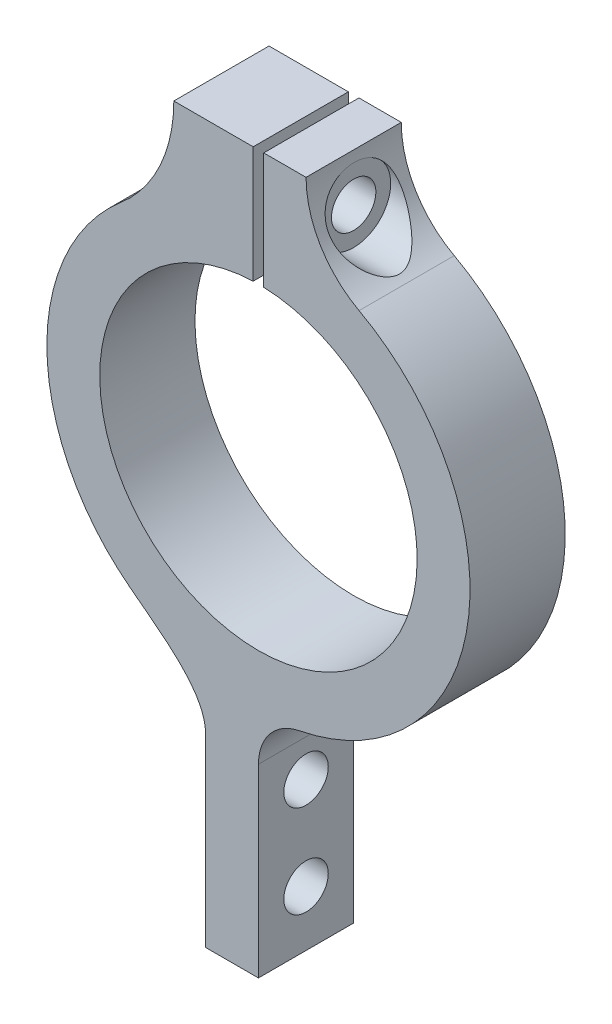
from build123d import *

# Parameters (mm, degrees)
MAIN_BODY_DEPTH      = 18
SKETCH14_W           = 4.2
SKETCH14_H           = 39
M8_CLEARANCE_HOLE2_D = 8.4
M8_CLEARANCE_HOLE3_D = 8.4
SKETCH27_R           = 7
CUT_EXTRUDE2_DEPTH   = 99.559772913


with BuildPart() as part:
    # Sketch1 → main body (new body)
    with BuildSketch(Plane.XY):
        with BuildLine():
            Line((0, -48.600411521), (0, -83.600411521))
            Line((0, -83.600411521), (-10, -83.600411521))
            Line((-10, -83.600411521), (-10, -48.600411521))
            add(Edge.make_bspline(
                [(-26.535230031, -29.931280748), (-20.948212629, -34.88438627), (-10, -40.904022772), (-10, -48.600411521)],
                knots=[0, 0, 0, 0, 1, 1, 1, 1], degree=3))
            ThreePointArc((-26.535230031, -29.931280748), (-39.998128482, 0.386934068), (-25.951219512, 30.43902439))
            ThreePointArc((-25.951219512, 30.43902439), (-18.607817439, 40.126684972), (-16, 52))
            Line((-16, 52), (-1, 52))
            Line((-1, 52), (-1, 29.983328701))
            ThreePointArc((-1, 29.983328701), (0, -30), (1, 29.983328701))
            Line((1, 29.983328701), (1, 52))
            Line((1, 52), (9, 52))
            ThreePointArc((9, 52), (11.695932832, 42.212959957), (19.02319236, 35.186903138))
            ThreePointArc((19.02319236, 35.186903138), (39.54457484, -6.018853774), (7.693084301, -39.253234949))
            ThreePointArc((7.693084301, -39.253234949), (2.170592409, -42.547452411), (0, -48.600411521))
        make_face()
    extrude(amount=MAIN_BODY_DEPTH)

    # Sketch14 → M8 Clearance Hole1 (revolve, cut)
    with BuildSketch(Plane(origin=(1, 43, 9), x_dir=(0, 0, 1), z_dir=(0, 1, 0))):
        with Locations((2.1, 19.5)):
            Rectangle(SKETCH14_W, SKETCH14_H)
    revolve(axis=Axis((-5.35, 43, 9), (1, 0, 0)), mode=Mode.SUBTRACT)

    # M8 Clearance Hole2 (through all)
    with Locations(Plane(origin=(1, 0, 0), x_dir=(0, 0, 1), z_dir=(1, 0, 0))):
        with Locations((9, -43)):
            Hole(M8_CLEARANCE_HOLE2_D / 2)

    # M8 Clearance Hole3 (through all)
    with Locations(Plane(origin=(0, 0, 0), x_dir=(0, 0, -1), z_dir=(1, 0, 0))):
        with Locations((-9, -55.600411521), (-9, -73.100411521)):
            Hole(M8_CLEARANCE_HOLE3_D / 2)

    # Sketch27 → Cut-Extrude2 (cut, through all)
    with BuildSketch(Plane(origin=(9, 0, 0), x_dir=(0, 0, -1), z_dir=(1, 0, 0))):
        with Locations((-9, 43)):
            Circle(SKETCH27_R)
    extrude(amount=CUT_EXTRUDE2_DEPTH, mode=Mode.SUBTRACT)


solid = part.part
